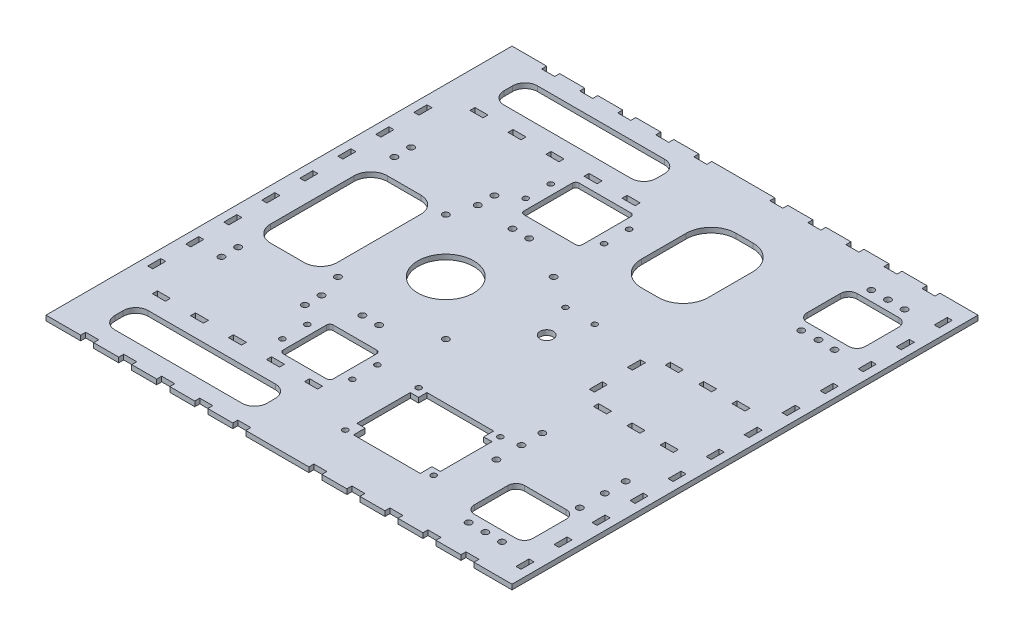
from build123d import *

# Parameters (mm, degrees)
SKETCH1_W               = 279.4
SKETCH1_H               = 279.4
BOSS_EXTRUDE1_DEPTH     = 3
SKETCH3_W               = 3
SKETCH3_H               = 7.8
CUT_EXTRUDE2_DEPTH      = 198.588410591
LPATTERN1_COUNT         = 12
LPATTERN1_PITCH         = 22.8
SKETCH5_W               = 7.8
SKETCH5_H               = 3
CUT_EXTRUDE3_DEPTH      = 198.588410591
LPATTERN2_COUNT         = 11
LPATTERN2_PITCH         = 22.8
MIRROR2_COPY_1_SKETCH_W = 7.8
MIRROR2_COPY_1_SKETCH_H = 3
MIRROR2_COPY_1_DEPTH    = 198.588410591
MIRROR2_COPY_2_SKETCH_W = 7.8
MIRROR2_COPY_2_SKETCH_H = 3
MIRROR2_COPY_2_DEPTH    = 198.588410591
MIRROR2_COPY_3_SKETCH_W = 7.8
MIRROR2_COPY_3_SKETCH_H = 3
MIRROR2_COPY_3_DEPTH    = 198.588410591
MIRROR2_COPY_4_SKETCH_W = 7.8
MIRROR2_COPY_4_SKETCH_H = 3
MIRROR2_COPY_4_DEPTH    = 198.588410591
MIRROR2_COPY_5_SKETCH_W = 7.8
MIRROR2_COPY_5_SKETCH_H = 3
MIRROR2_COPY_5_DEPTH    = 198.588410591
MIRROR2_COPY_6_SKETCH_W = 7.8
MIRROR2_COPY_6_SKETCH_H = 3
MIRROR2_COPY_6_DEPTH    = 198.588410591
MIRROR2_COPY_7_SKETCH_W = 7.8
MIRROR2_COPY_7_SKETCH_H = 3
MIRROR2_COPY_7_DEPTH    = 198.588410591
MIRROR2_COPY_8_SKETCH_W = 7.8
MIRROR2_COPY_8_SKETCH_H = 3
MIRROR2_COPY_8_DEPTH    = 198.588410591
MIRROR2_COPY_9_SKETCH_W = 7.8
MIRROR2_COPY_9_SKETCH_H = 3
MIRROR2_COPY_9_DEPTH    = 198.588410591
SKETCH6_W               = 3
SKETCH6_H               = 7.8
CUT_EXTRUDE4_DEPTH      = 198.588410591
LPATTERN3_COUNT         = 8
LPATTERN3_PITCH         = 22.8
SKETCH7_R               = 16.75
CUT_EXTRUDE5_DEPTH      = 198.588410591
F_6_CLEARANCE_HOLE1_D   = 3.7973
F_6_CLEARANCE_HOLE2_D   = 3.7973
SKETCH14_R              = 4
CUT_EXTRUDE6_DEPTH      = 198.588410591
SKETCH16_W              = 7.8
SKETCH16_H              = 3
CUT_EXTRUDE8_DEPTH      = 198.588410591
LPATTERN5_COUNT         = 5
LPATTERN5_PITCH         = 22.8
MIRROR4_COPY_1_SKETCH_W = 7.8
MIRROR4_COPY_1_SKETCH_H = 3
MIRROR4_COPY_1_DEPTH    = 198.588410591
MIRROR4_COPY_2_SKETCH_W = 7.8
MIRROR4_COPY_2_SKETCH_H = 3
MIRROR4_COPY_2_DEPTH    = 198.588410591
MIRROR4_COPY_3_SKETCH_W = 7.8
MIRROR4_COPY_3_SKETCH_H = 3
MIRROR4_COPY_3_DEPTH    = 198.588410591
MIRROR4_COPY_4_SKETCH_W = 7.8
MIRROR4_COPY_4_SKETCH_H = 3
MIRROR4_COPY_4_DEPTH    = 198.588410591
SKETCH17_W              = 7.8
SKETCH17_H              = 3
CUT_EXTRUDE9_DEPTH      = 198.588410591
LPATTERN6_COUNT         = 3
LPATTERN6_PITCH         = 20
SKETCH18_W              = 3
SKETCH18_H              = 7.8
CUT_EXTRUDE10_DEPTH     = 198.588410591
MIRROR5_COPY_1_SKETCH_W = 7.8
MIRROR5_COPY_1_SKETCH_H = 3
MIRROR5_COPY_1_DEPTH    = 198.588410591
MIRROR5_COPY_2_SKETCH_W = 7.8
MIRROR5_COPY_2_SKETCH_H = 3
MIRROR5_COPY_2_DEPTH    = 198.588410591
CUT_EXTRUDE11_DEPTH     = 198.588410591
F_4_CLEARANCE_HOLE1_D   = 3.2639
CUT_EXTRUDE12_REACH     = 199.588
F_6_CLEARANCE_HOLE3_D   = 3.7973
F_4_CLEARANCE_HOLE2_D   = 3.2639
CUT_EXTRUDE13_REACH     = 199.588
F_4_CLEARANCE_HOLE3_D   = 3.2639
CUT_EXTRUDE14_REACH     = 199.588


with BuildPart() as part:
    # Sketch1 → Boss-Extrude1 (new body)
    with BuildSketch(Plane(origin=(0, 0, 0), x_dir=(1, 0, 0), z_dir=(0, 1, 0))):
        Rectangle(SKETCH1_W, SKETCH1_H)
    extrude(amount=BOSS_EXTRUDE1_DEPTH)

    # Sketch3 → Cut-Extrude2 (cut, through all)
    with BuildSketch(Plane(origin=(0, 0, 0), x_dir=(-1, 0, 0), z_dir=(0, -1, 0))):
        with Locations((-133.2, 125.4)):
            Rectangle(SKETCH3_W, SKETCH3_H)
    cut_extrude2 = extrude(amount=-CUT_EXTRUDE2_DEPTH, mode=Mode.SUBTRACT)

    # LPattern1: Cut-Extrude2 ×12
    with Locations(*[(0, 0, i * LPATTERN1_PITCH) for i in range(1, LPATTERN1_COUNT)]):
        add(cut_extrude2, mode=Mode.SUBTRACT)

    # Sketch5 → Cut-Extrude3 (cut, through all)
    with BuildSketch(Plane.XZ):
        with Locations((113, -138.2)):
            Rectangle(SKETCH5_W, SKETCH5_H)
    cut_extrude3 = extrude(amount=-CUT_EXTRUDE3_DEPTH, mode=Mode.SUBTRACT)

    # LPattern2: Cut-Extrude3 ×11, 1 skipped
    with Locations(*[(-i * LPATTERN2_PITCH, 0, 0) for i in range(1, LPATTERN2_COUNT) if i not in (5,)]):
        add(cut_extrude3, mode=Mode.SUBTRACT)

    # Mirror2: Cut-Extrude3 across plane
    add(cut_extrude3.mirror(Plane.XY), mode=Mode.SUBTRACT)

    # Mirror2 copy 1 sketch → Mirror2 copy 1 (cut, through all)
    with BuildSketch(Plane(origin=(-22.8, 0, 0), x_dir=(1, 0, 0), z_dir=(0, -1, 0))):
        with Locations((113, 138.2)):
            Rectangle(MIRROR2_COPY_1_SKETCH_W, MIRROR2_COPY_1_SKETCH_H)
    extrude(amount=-MIRROR2_COPY_1_DEPTH, mode=Mode.SUBTRACT)

    # Mirror2 copy 2 sketch → Mirror2 copy 2 (cut, through all)
    with BuildSketch(Plane(origin=(-45.6, 0, 0), x_dir=(1, 0, 0), z_dir=(0, -1, 0))):
        with Locations((113, 138.2)):
            Rectangle(MIRROR2_COPY_2_SKETCH_W, MIRROR2_COPY_2_SKETCH_H)
    extrude(amount=-MIRROR2_COPY_2_DEPTH, mode=Mode.SUBTRACT)

    # Mirror2 copy 3 sketch → Mirror2 copy 3 (cut, through all)
    with BuildSketch(Plane(origin=(-68.4, 0, 0), x_dir=(1, 0, 0), z_dir=(0, -1, 0))):
        with Locations((113, 138.2)):
            Rectangle(MIRROR2_COPY_3_SKETCH_W, MIRROR2_COPY_3_SKETCH_H)
    extrude(amount=-MIRROR2_COPY_3_DEPTH, mode=Mode.SUBTRACT)

    # Mirror2 copy 4 sketch → Mirror2 copy 4 (cut, through all)
    with BuildSketch(Plane(origin=(-91.2, 0, 0), x_dir=(1, 0, 0), z_dir=(0, -1, 0))):
        with Locations((113, 138.2)):
            Rectangle(MIRROR2_COPY_4_SKETCH_W, MIRROR2_COPY_4_SKETCH_H)
    extrude(amount=-MIRROR2_COPY_4_DEPTH, mode=Mode.SUBTRACT)

    # Mirror2 copy 5 sketch → Mirror2 copy 5 (cut, through all)
    with BuildSketch(Plane(origin=(-136.8, 0, 0), x_dir=(1, 0, 0), z_dir=(0, -1, 0))):
        with Locations((113, 138.2)):
            Rectangle(MIRROR2_COPY_5_SKETCH_W, MIRROR2_COPY_5_SKETCH_H)
    extrude(amount=-MIRROR2_COPY_5_DEPTH, mode=Mode.SUBTRACT)

    # Mirror2 copy 6 sketch → Mirror2 copy 6 (cut, through all)
    with BuildSketch(Plane(origin=(-159.6, 0, 0), x_dir=(1, 0, 0), z_dir=(0, -1, 0))):
        with Locations((113, 138.2)):
            Rectangle(MIRROR2_COPY_6_SKETCH_W, MIRROR2_COPY_6_SKETCH_H)
    extrude(amount=-MIRROR2_COPY_6_DEPTH, mode=Mode.SUBTRACT)

    # Mirror2 copy 7 sketch → Mirror2 copy 7 (cut, through all)
    with BuildSketch(Plane(origin=(-182.4, 0, 0), x_dir=(1, 0, 0), z_dir=(0, -1, 0))):
        with Locations((113, 138.2)):
            Rectangle(MIRROR2_COPY_7_SKETCH_W, MIRROR2_COPY_7_SKETCH_H)
    extrude(amount=-MIRROR2_COPY_7_DEPTH, mode=Mode.SUBTRACT)

    # Mirror2 copy 8 sketch → Mirror2 copy 8 (cut, through all)
    with BuildSketch(Plane(origin=(-205.2, 0, 0), x_dir=(1, 0, 0), z_dir=(0, -1, 0))):
        with Locations((113, 138.2)):
            Rectangle(MIRROR2_COPY_8_SKETCH_W, MIRROR2_COPY_8_SKETCH_H)
    extrude(amount=-MIRROR2_COPY_8_DEPTH, mode=Mode.SUBTRACT)

    # Mirror2 copy 9 sketch → Mirror2 copy 9 (cut, through all)
    with BuildSketch(Plane(origin=(-228, 0, 0), x_dir=(1, 0, 0), z_dir=(0, -1, 0))):
        with Locations((113, 138.2)):
            Rectangle(MIRROR2_COPY_9_SKETCH_W, MIRROR2_COPY_9_SKETCH_H)
    extrude(amount=-MIRROR2_COPY_9_DEPTH, mode=Mode.SUBTRACT)

    # Sketch6 → Cut-Extrude4 (cut, through all)
    with BuildSketch(Plane.XZ):
        with Locations((-133.2, -79.8)):
            Rectangle(SKETCH6_W, SKETCH6_H)
    cut_extrude4 = extrude(amount=-CUT_EXTRUDE4_DEPTH, mode=Mode.SUBTRACT)

    # LPattern3: Cut-Extrude4 ×8
    with Locations(*[(0, 0, i * LPATTERN3_PITCH) for i in range(1, LPATTERN3_COUNT)]):
        add(cut_extrude4, mode=Mode.SUBTRACT)

    # Sketch7 → Cut-Extrude5 (cut, through all)
    with BuildSketch(Plane(origin=(0, 0, 0), x_dir=(-1, 0, 0), z_dir=(0, -1, 0))):
        with Locations(Location((39.7, 0, 0), (0, 0, 90))):
            Circle(SKETCH7_R)
    extrude(amount=-CUT_EXTRUDE5_DEPTH, mode=Mode.SUBTRACT)

    # #6 Clearance Hole1 (through all)
    with Locations(Plane(origin=(0, 3, 0), x_dir=(1, 0, 0), z_dir=(0, 1, 0))):
        with Locations((-72.025, -32.325), (-72.025, 32.325), (-7.375, 32.325), (-7.375, -32.325)):
            Hole(F_6_CLEARANCE_HOLE1_D / 2)

    # #6 Clearance Hole2 (through all)
    with Locations(Plane(origin=(0, 3, 0), x_dir=(1, 0, 0), z_dir=(0, 1, 0))):
        with Locations((-117.36, 56.83), (-67.36, 56.83), (-117.36, -56.83), (-67.36, -56.83), (-67.36, -46.83), (-117.36, -46.83), (-67.36, 46.83), (-117.36, 46.83)):
            Hole(F_6_CLEARANCE_HOLE2_D / 2)

    # Sketch14 → Cut-Extrude6 (cut, through all)
    with BuildSketch(Plane(origin=(0, 0, 0), x_dir=(-1, 0, 0), z_dir=(0, -1, 0))):
        with Locations(Location((-20.8, 0, 0), (0, 0, 90))):
            Circle(SKETCH14_R)
    extrude(amount=-CUT_EXTRUDE6_DEPTH, mode=Mode.SUBTRACT)

    # Sketch16 → Cut-Extrude8 (cut, through all)
    with BuildSketch(Plane.XZ):
        with Locations((-115, 95.2)):
            Rectangle(SKETCH16_W, SKETCH16_H)
    cut_extrude8 = extrude(amount=-CUT_EXTRUDE8_DEPTH, mode=Mode.SUBTRACT)

    # LPattern5: Cut-Extrude8 ×5
    with Locations(*[(i * LPATTERN5_PITCH, 0, 0) for i in range(1, LPATTERN5_COUNT)]):
        add(cut_extrude8, mode=Mode.SUBTRACT)

    # Mirror4: Cut-Extrude8 across plane
    add(cut_extrude8.mirror(Plane.XY), mode=Mode.SUBTRACT)

    # Mirror4 copy 1 sketch → Mirror4 copy 1 (cut, through all)
    with BuildSketch(Plane(origin=(22.8, 0, 0), x_dir=(1, 0, 0), z_dir=(0, -1, 0))):
        with Locations((-115, -95.2)):
            Rectangle(MIRROR4_COPY_1_SKETCH_W, MIRROR4_COPY_1_SKETCH_H)
    extrude(amount=-MIRROR4_COPY_1_DEPTH, mode=Mode.SUBTRACT)

    # Mirror4 copy 2 sketch → Mirror4 copy 2 (cut, through all)
    with BuildSketch(Plane(origin=(45.6, 0, 0), x_dir=(1, 0, 0), z_dir=(0, -1, 0))):
        with Locations((-115, -95.2)):
            Rectangle(MIRROR4_COPY_2_SKETCH_W, MIRROR4_COPY_2_SKETCH_H)
    extrude(amount=-MIRROR4_COPY_2_DEPTH, mode=Mode.SUBTRACT)

    # Mirror4 copy 3 sketch → Mirror4 copy 3 (cut, through all)
    with BuildSketch(Plane(origin=(68.4, 0, 0), x_dir=(1, 0, 0), z_dir=(0, -1, 0))):
        with Locations((-115, -95.2)):
            Rectangle(MIRROR4_COPY_3_SKETCH_W, MIRROR4_COPY_3_SKETCH_H)
    extrude(amount=-MIRROR4_COPY_3_DEPTH, mode=Mode.SUBTRACT)

    # Mirror4 copy 4 sketch → Mirror4 copy 4 (cut, through all)
    with BuildSketch(Plane(origin=(91.2, 0, 0), x_dir=(1, 0, 0), z_dir=(0, -1, 0))):
        with Locations((-115, -95.2)):
            Rectangle(MIRROR4_COPY_4_SKETCH_W, MIRROR4_COPY_4_SKETCH_H)
    extrude(amount=-MIRROR4_COPY_4_DEPTH, mode=Mode.SUBTRACT)

    # Sketch17 → Cut-Extrude9 (cut, through all)
    with BuildSketch(Plane.XZ):
        with Locations((115.8, 21.5)):
            Rectangle(SKETCH17_W, SKETCH17_H)
    cut_extrude9 = extrude(amount=-CUT_EXTRUDE9_DEPTH, mode=Mode.SUBTRACT)

    # LPattern6: Cut-Extrude9 ×3
    with Locations(*[(-i * LPATTERN6_PITCH, 0, 0) for i in range(1, LPATTERN6_COUNT)]):
        add(cut_extrude9, mode=Mode.SUBTRACT)

    # Sketch18 → Cut-Extrude10 (cut, through all)
    with BuildSketch(Plane(origin=(0, 0, 0), x_dir=(-1, 0, 0), z_dir=(0, -1, 0))):
        with Locations((-63.2, -11.4)):
            Rectangle(SKETCH18_W, SKETCH18_H)
    cut_extrude10 = extrude(amount=-CUT_EXTRUDE10_DEPTH, mode=Mode.SUBTRACT)

    # Mirror5: Cut-Extrude9, Cut-Extrude10 across plane
    add(cut_extrude9.mirror(Plane.XY), mode=Mode.SUBTRACT)
    add(cut_extrude10.mirror(Plane.XY), mode=Mode.SUBTRACT)

    # Mirror5 copy 1 sketch → Mirror5 copy 1 (cut, through all)
    with BuildSketch(Plane(origin=(-20, 0, 0), x_dir=(1, 0, 0), z_dir=(0, -1, 0))):
        with Locations((115.8, -21.5)):
            Rectangle(MIRROR5_COPY_1_SKETCH_W, MIRROR5_COPY_1_SKETCH_H)
    extrude(amount=-MIRROR5_COPY_1_DEPTH, mode=Mode.SUBTRACT)

    # Mirror5 copy 2 sketch → Mirror5 copy 2 (cut, through all)
    with BuildSketch(Plane(origin=(-40, 0, 0), x_dir=(1, 0, 0), z_dir=(0, -1, 0))):
        with Locations((115.8, -21.5)):
            Rectangle(MIRROR5_COPY_2_SKETCH_W, MIRROR5_COPY_2_SKETCH_H)
    extrude(amount=-MIRROR5_COPY_2_DEPTH, mode=Mode.SUBTRACT)

    # Sketch19 → Cut-Extrude11 (cut, through all)
    with BuildSketch(Plane.XZ):
        with BuildLine():
            Line((24.7, -109.7), (34.7, -109.7))
            ThreePointArc((34.7, -109.7), (45.306601718, -105.306601718), (49.7, -94.7))
            Line((49.7, -94.7), (49.7, -68))
            ThreePointArc((49.7, -68), (45.306601718, -57.393398282), (34.7, -53))
            Line((34.7, -53), (24.7, -53))
            ThreePointArc((24.7, -53), (14.093398282, -57.393398282), (9.7, -68))
            Line((9.7, -68), (9.7, -94.7))
            ThreePointArc((9.7, -94.7), (14.093398282, -105.306601718), (24.7, -109.7))
        make_face()
        with BuildLine():
            Line((-89.7, 35), (-109.7, 35))
            ThreePointArc((-109.7, 35), (-116.771067812, 32.071067812), (-119.7, 25))
            Line((-119.7, 25), (-119.7, -25))
            ThreePointArc((-119.7, -25), (-116.771067812, -32.071067812), (-109.7, -35))
            Line((-109.7, -35), (-89.7, -35))
            ThreePointArc((-89.7, -35), (-82.628932188, -32.071067812), (-79.7, -25))
            Line((-79.7, -25), (-79.7, 25))
            ThreePointArc((-79.7, 25), (-82.628932188, 32.071067812), (-89.7, 35))
        make_face()
        Polygon((14.7, 65.7), (54.7, 65.7), (54.7, 71.7), (59.7, 71.7), (59.7, 102.7), (54.7, 102.7), (54.7, 109.7), (14.7, 109.7), (14.7, 102.7), (9.7, 102.7), (9.7, 70.7), (14.7, 70.7), align=None)
    extrude(amount=-CUT_EXTRUDE11_DEPTH, mode=Mode.SUBTRACT)

    # #4 Clearance Hole1 (through all)
    with Locations(Plane(origin=(0, 3, 0), x_dir=(1, 0, 0), z_dir=(0, 1, 0))):
        with Locations((9.7, -65.7), (59.7, -66.7), (59.7, -106.7), (9.7, -109.7)):
            Hole(F_4_CLEARANCE_HOLE1_D / 2)

    # Sketch22 → Cut-Extrude12 (cut, up to next)
    with BuildSketch(Plane(origin=(0, 3, 0), x_dir=(1, 0, 0), z_dir=(0, 1, 0)), mode=Mode.PRIVATE) as cut_extrude12_sk1:
        with BuildLine():
            Line((92.2, -84.7), (117.2, -84.7))
            ThreePointArc((117.2, -84.7), (120.735533906, -86.164466094), (122.2, -89.7))
            Line((122.2, -89.7), (122.2, -109.7))
            ThreePointArc((122.2, -109.7), (120.735533906, -113.235533906), (117.2, -114.7))
            Line((117.2, -114.7), (92.2, -114.7))
            ThreePointArc((92.2, -114.7), (88.664466094, -113.235533906), (87.2, -109.7))
            Line((87.2, -109.7), (87.2, -89.7))
            ThreePointArc((87.2, -89.7), (88.664466094, -86.164466094), (92.2, -84.7))
        make_face()
    cut_extrude12_tool1 = extrude(cut_extrude12_sk1.sketch, amount=-CUT_EXTRUDE12_REACH, mode=Mode.PRIVATE) & part.part
    # Sketch22 → Cut-Extrude12 (cut, up to next)
    with BuildSketch(Plane(origin=(0, 3, 0), x_dir=(1, 0, 0), z_dir=(0, 1, 0)), mode=Mode.PRIVATE) as cut_extrude12_sk2:
        with BuildLine():
            Line((92.2, 114.7), (117.2, 114.7))
            ThreePointArc((117.2, 114.7), (120.735533906, 113.235533906), (122.2, 109.7))
            Line((122.2, 109.7), (122.2, 89.7))
            ThreePointArc((122.2, 89.7), (120.735533906, 86.164466094), (117.2, 84.7))
            Line((117.2, 84.7), (92.2, 84.7))
            ThreePointArc((92.2, 84.7), (88.664466094, 86.164466094), (87.2, 89.7))
            Line((87.2, 89.7), (87.2, 109.7))
            ThreePointArc((87.2, 109.7), (88.664466094, 113.235533906), (92.2, 114.7))
        make_face()
    cut_extrude12_tool2 = extrude(cut_extrude12_sk2.sketch, amount=-CUT_EXTRUDE12_REACH, mode=Mode.PRIVATE) & part.part
    add(cut_extrude12_tool1.solids().sort_by_distance((104.7, 3, 99.7))[0], mode=Mode.SUBTRACT)
    add(cut_extrude12_tool2.solids().sort_by_distance((104.7, 3, -99.7))[0], mode=Mode.SUBTRACT)

    # #6 Clearance Hole3 (through all)
    with Locations(Plane(origin=(0, 3, 0), x_dir=(1, 0, 0), z_dir=(0, 1, 0))):
        with Locations((94.7, 120.7), (114.7, 120.7), (114.7, 78.7), (94.7, 78.7), (104.7, 79.030891432), (104.7, 120.7), (70.35, -52.2), (70.35, -79.7), (70.35, -64.7), (120.35, -64.7), (120.35, -52.2), (120.35, -79.7), (161.748665947, 56.976330935), (114.7, -120.7), (104.7, -120.7), (94.7, -120.7), (-44.7, 45), (-34.7, 45), (-44.7, -45), (-34.7, -45)):
            Hole(F_6_CLEARANCE_HOLE3_D / 2)

    # #4 Clearance Hole2 (through all)
    with Locations(Plane(origin=(0, 3, 0), x_dir=(1, 0, 0), z_dir=(0, 1, 0))):
        with Locations((12.05, 20), (29.55, 20)):
            Hole(F_4_CLEARANCE_HOLE2_D / 2)

    # Sketch29 → Cut-Extrude13 (cut, up to next)
    with BuildSketch(Plane(origin=(0, 3, 0), x_dir=(1, 0, 0), z_dir=(0, 1, 0)), mode=Mode.PRIVATE) as cut_extrude13_sk1:
        with BuildLine():
            Line((-50.5, -86.7), (-50.5, -60.7))
            ThreePointArc((-50.5, -60.7), (-49.914213562, -59.285786438), (-48.5, -58.7))
            Line((-48.5, -58.7), (-22.5, -58.7))
            ThreePointArc((-22.5, -58.7), (-21.085786438, -59.285786438), (-20.5, -60.7))
            Line((-20.5, -60.7), (-20.5, -74.263586196))
            Line((-20.5, -74.263586196), (-20.5, -86.7))
            ThreePointArc((-20.5, -86.7), (-21.085786438, -88.114213562), (-22.5, -88.7))
            Line((-22.5, -88.7), (-48.5, -88.7))
            ThreePointArc((-48.5, -88.7), (-49.914213562, -88.114213562), (-50.5, -86.7))
        make_face()
    cut_extrude13_tool1 = extrude(cut_extrude13_sk1.sketch, amount=-CUT_EXTRUDE13_REACH, mode=Mode.PRIVATE) & part.part
    # Sketch29 → Cut-Extrude13 (cut, up to next)
    with BuildSketch(Plane(origin=(0, 3, 0), x_dir=(1, 0, 0), z_dir=(0, 1, 0)), mode=Mode.PRIVATE) as cut_extrude13_sk2:
        with BuildLine():
            Line((-17.5, 88.7), (-48.5, 88.7))
            ThreePointArc((-48.5, 88.7), (-49.914213562, 88.114213562), (-50.5, 86.7))
            Line((-50.5, 86.7), (-50.5, 57.7))
            ThreePointArc((-50.5, 57.7), (-49.914213562, 56.285786438), (-48.5, 55.7))
            Line((-48.5, 55.7), (-17.5, 55.7))
            ThreePointArc((-17.5, 55.7), (-16.085786438, 56.285786438), (-15.5, 57.7))
            Line((-15.5, 57.7), (-15.5, 86.7))
            ThreePointArc((-15.5, 86.7), (-16.085786438, 88.114213562), (-17.5, 88.7))
        make_face()
    cut_extrude13_tool2 = extrude(cut_extrude13_sk2.sketch, amount=-CUT_EXTRUDE13_REACH, mode=Mode.PRIVATE) & part.part
    add(cut_extrude13_tool1.solids().sort_by_distance((-35.5, 3, 73.7))[0], mode=Mode.SUBTRACT)
    add(cut_extrude13_tool2.solids().sort_by_distance((-33, 3, -72.2))[0], mode=Mode.SUBTRACT)

    # #4 Clearance Hole3 (through all)
    with Locations(Plane(origin=(0, 3, 0), x_dir=(1, 0, 0), z_dir=(0, 1, 0))):
        with Locations((-56.5, 64.7), (-56.5, 79.7), (-9.5, 79.7), (-9.5, 64.7), (-56.5, -66.2), (-14.5, -66.2), (-14.5, -81.2), (-56.5, -81.2)):
            Hole(F_4_CLEARANCE_HOLE3_D / 2)

    # Sketch33 → Cut-Extrude14 (cut, up to next)
    with BuildSketch(Plane(origin=(0, 3, 0), x_dir=(1, 0, 0), z_dir=(0, 1, 0)), mode=Mode.PRIVATE) as cut_extrude14_sk1:
        with BuildLine():
            Line((-111.4, -126.7), (-35.2, -126.7))
            ThreePointArc((-35.2, -126.7), (-29.896699141, -124.503300859), (-27.7, -119.2))
            Line((-27.7, -119.2), (-27.7, -114.2))
            ThreePointArc((-27.7, -114.2), (-29.896699141, -108.896699141), (-35.2, -106.7))
            Line((-35.2, -106.7), (-111.4, -106.7))
            ThreePointArc((-111.4, -106.7), (-116.703300859, -108.896699141), (-118.9, -114.2))
            Line((-118.9, -114.2), (-118.9, -119.2))
            ThreePointArc((-118.9, -119.2), (-116.703300859, -124.503300859), (-111.4, -126.7))
        make_face()
    cut_extrude14_tool1 = extrude(cut_extrude14_sk1.sketch, amount=-CUT_EXTRUDE14_REACH, mode=Mode.PRIVATE) & part.part
    # Sketch33 → Cut-Extrude14 (cut, up to next)
    with BuildSketch(Plane(origin=(0, 3, 0), x_dir=(1, 0, 0), z_dir=(0, 1, 0)), mode=Mode.PRIVATE) as cut_extrude14_sk2:
        with BuildLine():
            Line((-111.4, 106.7), (-35.2, 106.7))
            ThreePointArc((-35.2, 106.7), (-29.896699141, 108.896699141), (-27.7, 114.2))
            Line((-27.7, 114.2), (-27.7, 119.2))
            ThreePointArc((-27.7, 119.2), (-29.896699141, 124.503300859), (-35.2, 126.7))
            Line((-35.2, 126.7), (-111.4, 126.7))
            ThreePointArc((-111.4, 126.7), (-116.703300859, 124.503300859), (-118.9, 119.2))
            Line((-118.9, 119.2), (-118.9, 114.2))
            ThreePointArc((-118.9, 114.2), (-116.703300859, 108.896699141), (-111.4, 106.7))
        make_face()
    cut_extrude14_tool2 = extrude(cut_extrude14_sk2.sketch, amount=-CUT_EXTRUDE14_REACH, mode=Mode.PRIVATE) & part.part
    add(cut_extrude14_tool1.solids().sort_by_distance((-73.3, 3, 116.7))[0], mode=Mode.SUBTRACT)
    add(cut_extrude14_tool2.solids().sort_by_distance((-73.3, 3, -116.7))[0], mode=Mode.SUBTRACT)


solid = part.part
